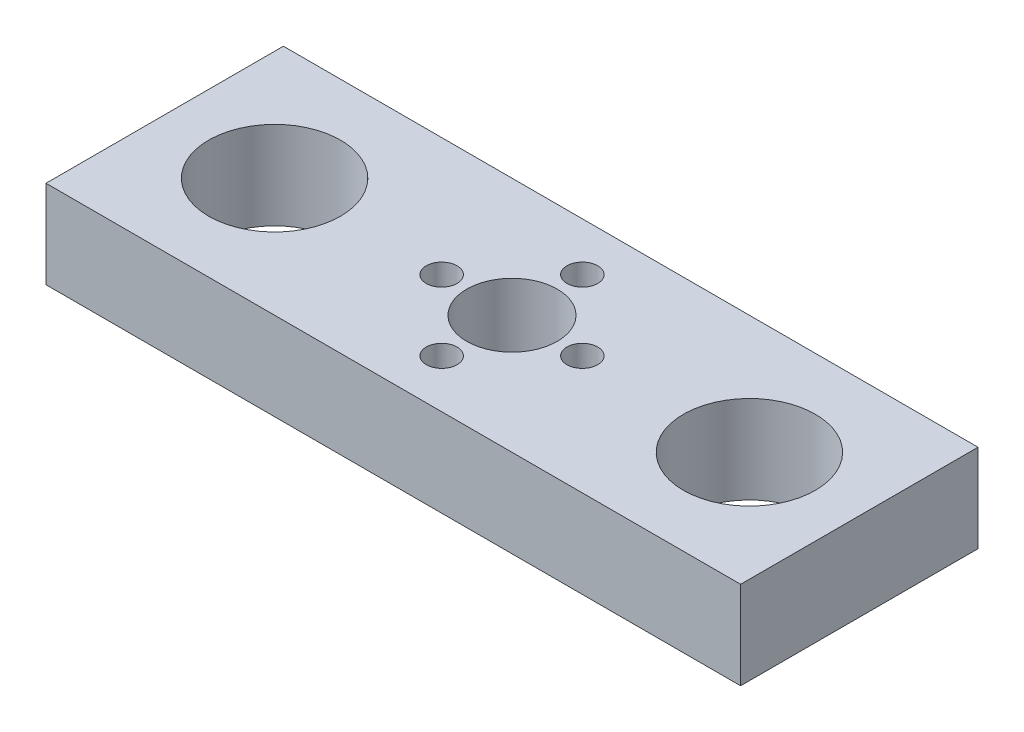
from build123d import *

# Parameters (mm, degrees)
SKETCH_1_W          = 79
SKETCH_1_H          = 27
EXTRUDE_1_DEPTH     = 10
SKETCH_3_R          = 7.5
CUT_EXTRUDE_1_DEPTH = 43.924352063
SKETCH_4_R          = 5.15
CUT_EXTRUDE_2_DEPTH = 43.924352063
SKETCH_5_R          = 1.75
SKETCH_5_R_2        = 1.749999993
CUT_EXTRUDE_3_DEPTH = 43.924352063


with BuildPart() as part:
    # 草图1 → 凸台-拉伸1 (new body)
    with BuildSketch(Plane(origin=(0, 0, 0), x_dir=(1, 0, 0), z_dir=(0, 1, 0))):
        Rectangle(SKETCH_1_W, SKETCH_1_H)
    extrude(amount=EXTRUDE_1_DEPTH)

    # 草图3 → 切除-拉伸1 (cut, through all)
    with BuildSketch(Plane(origin=(0, 10, 0), x_dir=(1, 0, 0), z_dir=(0, 1, 0))):
        with Locations((-27, 0)):
            Circle(SKETCH_3_R)
        with Locations((27, 0)):
            Circle(SKETCH_3_R)
    extrude(amount=-CUT_EXTRUDE_1_DEPTH, mode=Mode.SUBTRACT)

    # 草图4 → 切除-拉伸2 (cut, through all)
    with BuildSketch(Plane(origin=(0, 10, 0), x_dir=(1, 0, 0), z_dir=(0, 1, 0))):
        Circle(SKETCH_4_R)
    extrude(amount=-CUT_EXTRUDE_2_DEPTH, mode=Mode.SUBTRACT)

    # 草图5 → 切除-拉伸3 (cut, through all)
    with BuildSketch(Plane(origin=(0, 10, 0), x_dir=(1, 0, 0), z_dir=(0, 1, 0))):
        with Locations((8, 0)):
            Circle(SKETCH_5_R)
        with Locations((-8, 0)):
            Circle(SKETCH_5_R)
        with Locations((0, 8)):
            Circle(SKETCH_5_R_2)
        with Locations((0, -8)):
            Circle(SKETCH_5_R_2)
    extrude(amount=-CUT_EXTRUDE_3_DEPTH, mode=Mode.SUBTRACT)


solid = part.part
